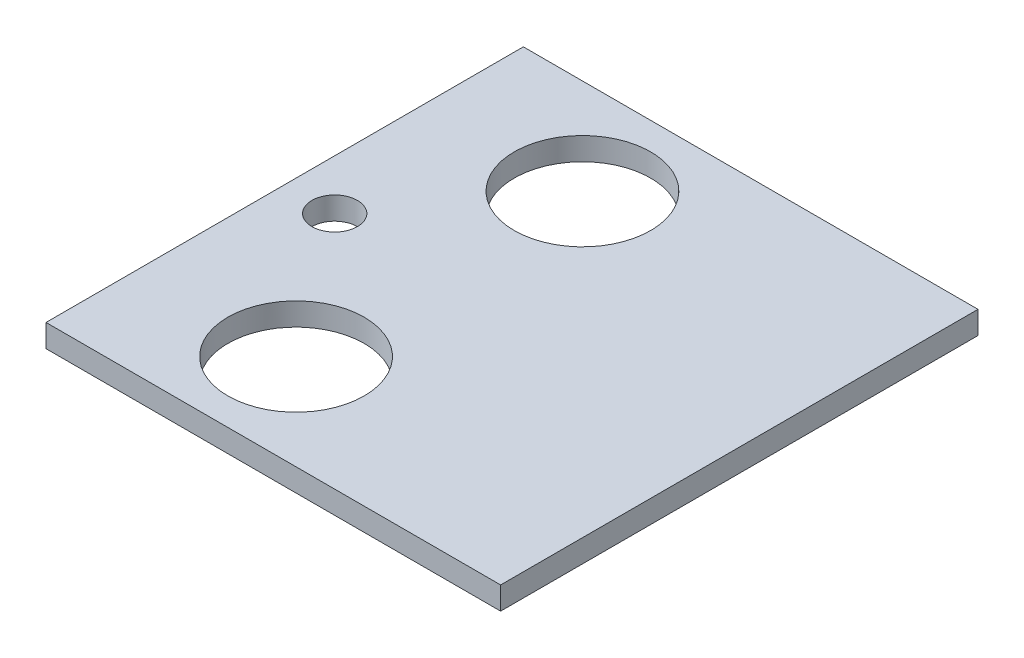
from build123d import *

# Parameters (mm, degrees)
SKETCH2_W           = 100
SKETCH2_H           = 105
BOSS_EXTRUDE1_DEPTH = 5
SKETCH5_R           = 15
SKETCH5_R_2         = 5
CUT_EXTRUDE1_DEPTH  = 6


with BuildPart() as part:
    # Sketch2 → Boss-Extrude1 (new body)
    with BuildSketch(Plane(origin=(0, 0, 0), x_dir=(1, 0, 0), z_dir=(0, 1, 0))):
        Rectangle(SKETCH2_W, SKETCH2_H)
    extrude(amount=BOSS_EXTRUDE1_DEPTH)

    # Sketch5 → Cut-Extrude1 (cut)
    with BuildSketch(Plane.XZ):
        with Locations((-16.005435425, 31.5)):
            Circle(SKETCH5_R)
        with Locations((-39, 0)):
            Circle(SKETCH5_R_2)
    cut_extrude1 = extrude(amount=-CUT_EXTRUDE1_DEPTH, mode=Mode.SUBTRACT)

    # Mirror1: Cut-Extrude1 across plane
    add(cut_extrude1.mirror(Plane.XY), mode=Mode.SUBTRACT)


solid = part.part
